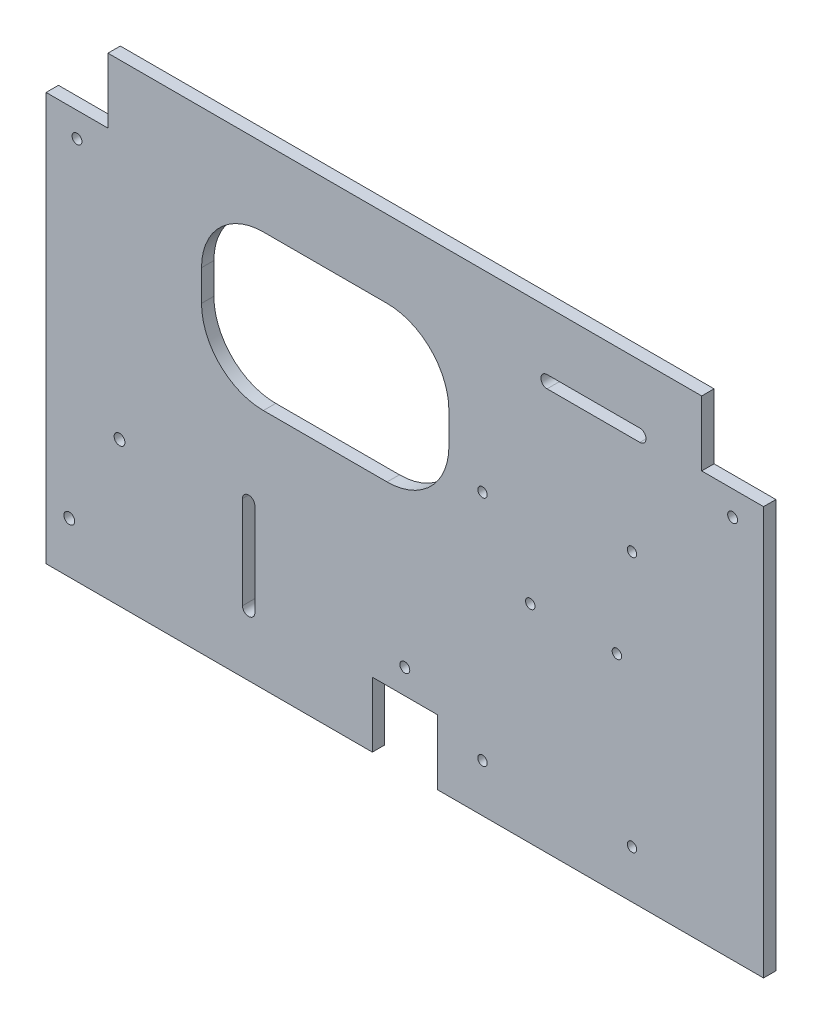
from build123d import *

# Parameters (mm, degrees)
SKETCH1_W           = 232
SKETCH1_H           = 170
BOSS_EXTRUDE1_DEPTH = 4
CUT_EXTRUDE4_DEPTH  = 144.864519601
SKETCH6_R           = 1.523418559
CUT_EXTRUDE5_DEPTH  = 144.864519601
SKETCH8_W           = 232
SKETCH8_H           = 5
CUT_EXTRUDE7_DEPTH  = 144.864519601
SKETCH9_R           = 1.6
CUT_EXTRUDE8_DEPTH  = 144.864519601
SKETCH10_R          = 1.75
CUT_EXTRUDE9_DEPTH  = 144.864519601
SKETCH11_W          = 20
SKETCH11_H          = 33
CUT_EXTRUDE10_DEPTH = 144.864519601
SKETCH12_W          = 21
SKETCH12_H          = 21
CUT_EXTRUDE11_DEPTH = 4
CUT_EXTRUDE12_DEPTH = 4
SKETCH14_W          = 192
SKETCH14_H          = 12
CUT_EXTRUDE13_DEPTH = 4


with BuildPart() as part:
    # Sketch1 → Boss-Extrude1 (new body)
    with BuildSketch(Plane.XY):
        Rectangle(SKETCH1_W, SKETCH1_H)
    extrude(amount=BOSS_EXTRUDE1_DEPTH)

    # Sketch5 → Cut-Extrude4 (cut, through all)
    with BuildSketch(Plane.XY.offset(4)):
        with BuildLine():
            Line((-45.739568187, -1.949021099), (-5.739568187, -1.949021099))
            ThreePointArc((-5.739568187, -1.949021099), (8.402567437, 3.908843277), (14.260431813, 18.050978901))
            Line((14.260431813, 18.050978901), (14.260431813, 28.050978901))
            ThreePointArc((14.260431813, 28.050978901), (8.402567437, 42.193114525), (-5.739568187, 48.050978901))
            Line((-5.739568187, 48.050978901), (-45.739568187, 48.050978901))
            ThreePointArc((-45.739568187, 48.050978901), (-59.881703811, 42.193114525), (-65.739568187, 28.050978901))
            Line((-65.739568187, 28.050978901), (-65.739568187, 18.050978901))
            ThreePointArc((-65.739568187, 18.050978901), (-59.881703811, 3.908843277), (-45.739568187, -1.949021099))
        make_face()
    extrude(amount=-CUT_EXTRUDE4_DEPTH, mode=Mode.SUBTRACT)

    # Sketch6 → Cut-Extrude5 (cut, through all)
    with BuildSketch(Plane.XY.offset(4)):
        with Locations((73.46, 18.0986)):
            Circle(SKETCH6_R)
        with Locations((25.1238, 10.6056)):
            Circle(SKETCH6_R)
        with Locations((68.581507234, -12.9021)):
            Circle(SKETCH6_R)
        with Locations((40.565307234, -12.9021)):
            Circle(SKETCH6_R)
        with Locations((73.46, -64.5276)):
            Circle(SKETCH6_R)
        with Locations((25.1238, -64.5276)):
            Circle(SKETCH6_R)
    extrude(amount=-CUT_EXTRUDE5_DEPTH, mode=Mode.SUBTRACT)

    # Sketch8 → Cut-Extrude7 (cut, through all)
    with BuildSketch(Plane.XY.offset(4)):
        with Locations((0, -82.5)):
            Rectangle(SKETCH8_W, SKETCH8_H)
    extrude(amount=-CUT_EXTRUDE7_DEPTH, mode=Mode.SUBTRACT)

    # Sketch9 → Cut-Extrude8 (cut, through all)
    with BuildSketch(Plane(origin=(0, 0, 0), x_dir=(-1, 0, 0), z_dir=(0, 0, -1))):
        with Locations((106, 44)):
            Circle(SKETCH9_R)
        with Locations((-106, 44)):
            Circle(SKETCH9_R)
        with Locations((0, -51.000000508)):
            Circle(SKETCH9_R)
    extrude(amount=-CUT_EXTRUDE8_DEPTH, mode=Mode.SUBTRACT)

    # Sketch10 → Cut-Extrude9 (cut, through all)
    with BuildSketch(Plane.XY.offset(4)):
        with Locations((-92.249999997, -33.300000021)):
            Circle(SKETCH10_R)
        with Locations((-108.499999997, -63.500000021)):
            Circle(SKETCH10_R)
    extrude(amount=-CUT_EXTRUDE9_DEPTH, mode=Mode.SUBTRACT)

    # Sketch11 → Cut-Extrude10 (cut, through all)
    with BuildSketch(Plane.XY.offset(4)):
        with Locations((106, 68.5)):
            Rectangle(SKETCH11_W, SKETCH11_H)
    cut_extrude10 = extrude(amount=-CUT_EXTRUDE10_DEPTH, mode=Mode.SUBTRACT)

    # Mirror1: Cut-Extrude10 across plane
    add(cut_extrude10.mirror(Plane.ZY), mode=Mode.SUBTRACT)

    # Sketch12 → Cut-Extrude11 (cut)
    with BuildSketch(Plane.XY.offset(4)):
        with Locations((0, -69.5)):
            Rectangle(SKETCH12_W, SKETCH12_H)
    extrude(amount=-CUT_EXTRUDE11_DEPTH, mode=Mode.SUBTRACT)

    # Sketch13 → Cut-Extrude12 (cut)
    with BuildSketch(Plane.XY.offset(4)):
        with BuildLine():
            Line((-48.5, -30), (-48.5, -60))
            ThreePointArc((-48.5, -60), (-50.5, -62), (-52.5, -60))
            Line((-52.5, -60), (-52.5, -30))
            ThreePointArc((-52.5, -30), (-50.5, -28), (-48.5, -30))
        make_face()
        with BuildLine():
            Line((46, 54), (76, 54))
            ThreePointArc((76, 54), (78, 52), (76, 50))
            Line((76, 50), (46, 50))
            ThreePointArc((46, 50), (44, 52), (46, 54))
        make_face()
    extrude(amount=-CUT_EXTRUDE12_DEPTH, mode=Mode.SUBTRACT)

    # Sketch14 → Cut-Extrude13 (cut)
    with BuildSketch(Plane.XY.offset(4)):
        with Locations((0, 79)):
            Rectangle(SKETCH14_W, SKETCH14_H)
    extrude(amount=-CUT_EXTRUDE13_DEPTH, mode=Mode.SUBTRACT)


solid = part.part
